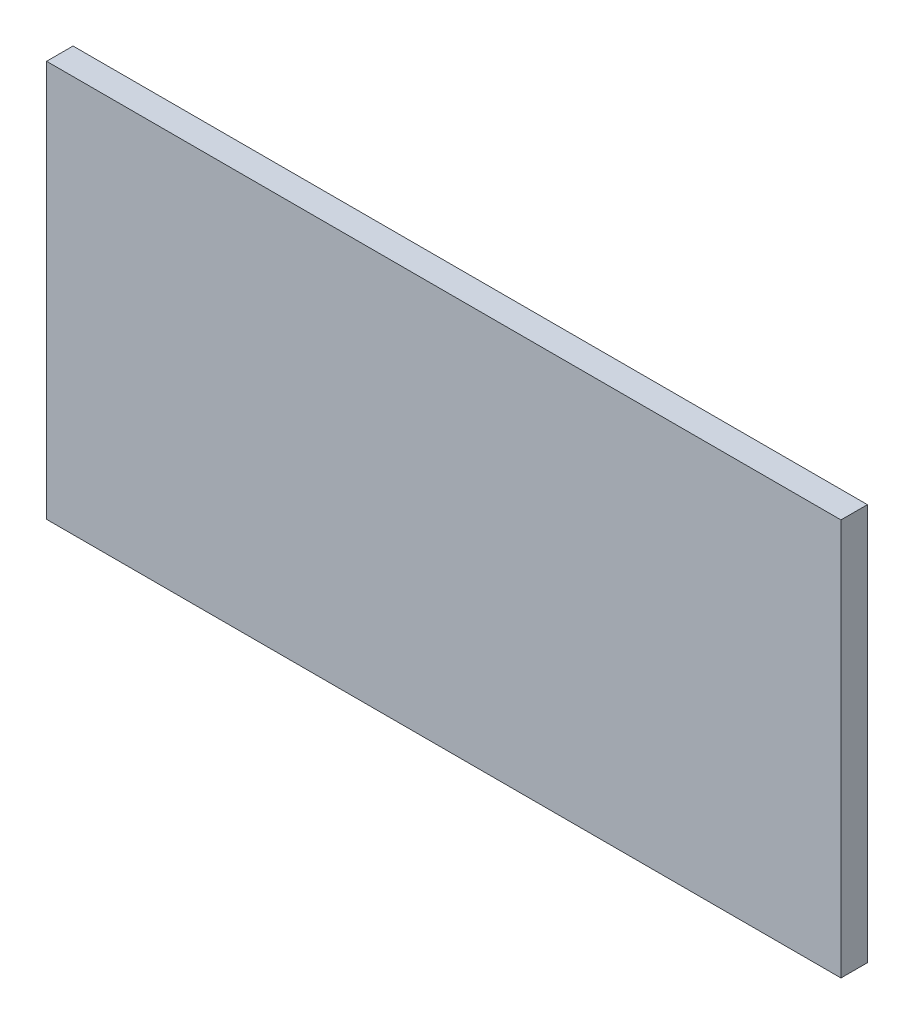
from build123d import *

# Parameters (mm, degrees)
SKETCH1_W           = 300.36
SKETCH1_H           = 150
BOSS_EXTRUDE1_DEPTH = 10


with BuildPart() as part:
    # Sketch1 → Boss-Extrude1 (new body)
    with BuildSketch(Plane.XY):
        Rectangle(SKETCH1_W, SKETCH1_H)
    extrude(amount=BOSS_EXTRUDE1_DEPTH)


solid = part.part
